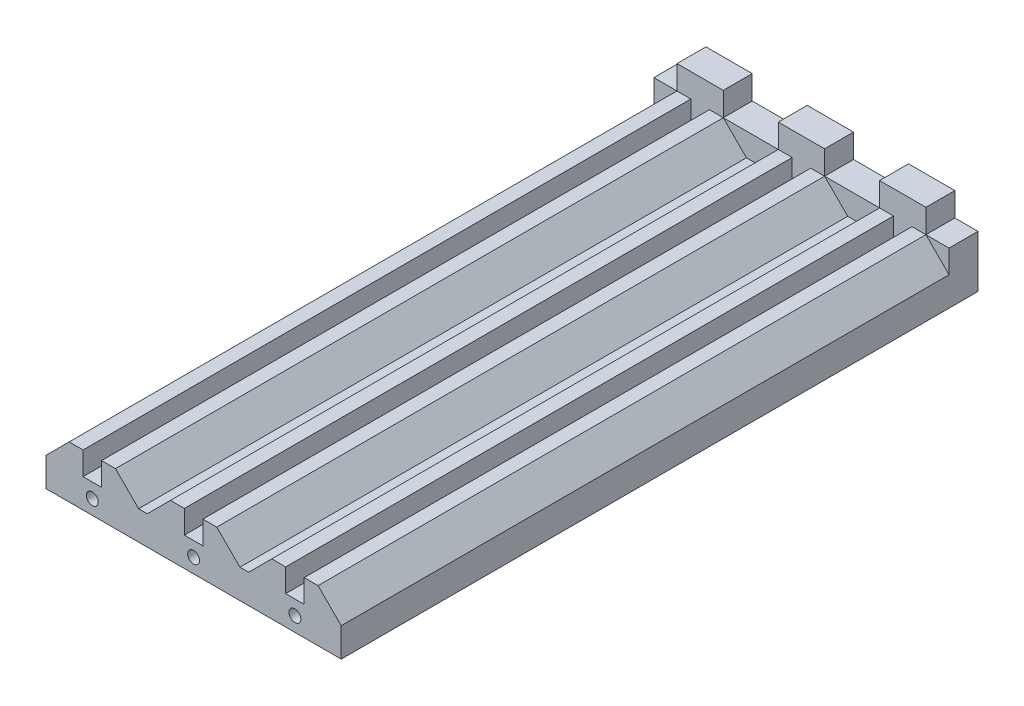
from build123d import *
from build123d.topology import SkipClean

# Parameters (mm, degrees)
EXTRUDE_1_DEPTH     = 170
CHAMFER_1_SIZE      = 8
SKETCH_2_W          = 170
SKETCH_2_H          = 10
CUT_EXTRUDE_1_DEPTH = 0.84
EXTRUDE_2_DEPTH     = 80
SKETCH_4_W          = 250
SKETCH_4_H          = 10
CUT_EXTRUDE_2_DEPTH = 12
SKETCH_5_W          = 101.997424074
SKETCH_5_H          = 18
EXTRUDE_3_DEPTH     = 10
SKETCH_6_R          = 2.05
CUT_EXTRUDE_3_DEPTH = 5
SKETCH_7_W          = 16
SKETCH_7_H          = 10
EXTRUDE_4_DEPTH     = 8.2
CUT_EXTRUDE_5_DEPTH = 40
SKETCH_11_R         = 2.05
CUT_EXTRUDE_6_DEPTH = 5


with BuildPart() as part:
    # 草图1 → 凸台-拉伸1 (new body)
    with BuildSketch(Plane.XY):
        Polygon((28.8, -113.2), (35.2, -113.2), (35.2, -105.2), (40, -105.2), (40, -113.2), (59, -113.2), (59, -105.2), (63.8, -105.2), (63.8, -113.2), (70.2, -113.2), (70.2, -105.2), (75, -105.2), (75, -113.2), (94, -113.2), (94, -105.2), (98.8, -105.2), (98.8, -113.2), (105.2, -113.2), (105.2, -105.2), (110, -105.2), (110, -113.2), (130, -113.2), (130, -123.2), (15.162575926, -123.2), (15.162575926, -113.2), (24, -113.2), (24, -105.2), (28.8, -105.2), align=None)
    extrude(amount=-EXTRUDE_1_DEPTH)

    # 倒角1
    chamfer_1_edges = [part.edges().sort_by_distance(p)[0] for p in [
        (24, -113.2, -85),
        (110, -113.2, -85),
        (94, -113.2, -85),
        (75, -113.2, -85),
        (59, -113.2, -85),
        (40, -113.2, -85),
    ]]
    chamfer(chamfer_1_edges, length=CHAMFER_1_SIZE - 0.0001)  # a hair under: the kernel refuses the full size

    # 草图2 → 切除-拉伸1 (cut)
    with BuildSketch(Plane.ZY.offset(-15.162575926)):
        with Locations((-85, -118.2)):
            Rectangle(SKETCH_2_W, SKETCH_2_H)
    extrude(amount=-CUT_EXTRUDE_1_DEPTH, mode=Mode.SUBTRACT)

    # 草图3 → 凸台-拉伸2 (add)
    with SkipClean():  # the faces are left unmerged after this step: merging them gives an invalid solid
        with BuildSketch(Plane.XY):
            Polygon((24, -105.2), (16, -113.2), (16.002575926, -113.2), (16.002575926, -123.2), (130, -123.2), (130, -113.2), (118, -113.2), (110, -105.2), (105.2, -105.2), (105.2, -113.2), (98.8, -113.2), (98.8, -105.2), (94, -105.2), (86, -113.2), (83, -113.2), (75, -105.2), (70.2, -105.2), (70.2, -113.2), (63.8, -113.2), (63.8, -105.2), (59, -105.2), (51, -113.2), (48, -113.2), (40, -105.2), (35.2, -105.2), (35.2, -113.2), (28.8, -113.2), (28.8, -105.2), align=None)
        extrude(amount=EXTRUDE_2_DEPTH)

    # 草图4 → 切除-拉伸2 (cut)
    with SkipClean():  # the faces are left unmerged after this step: merging them gives an invalid solid
        with BuildSketch(Plane(origin=(130, 0, 0), x_dir=(0, 0, -1), z_dir=(1, 0, 0))):
            with Locations((45, -118.2)):
                Rectangle(SKETCH_4_W, SKETCH_4_H)
        extrude(amount=-CUT_EXTRUDE_2_DEPTH, mode=Mode.SUBTRACT)

    # 草图5 → 凸台-拉伸3 (add)
    with SkipClean():  # the faces are left unmerged after this step: merging them gives an invalid solid
        with BuildSketch(Plane(origin=(0, 0, -170), x_dir=(-1, 0, 0), z_dir=(0, 0, -1))):
            with Locations((-67.001287963, -114.2)):
                Rectangle(SKETCH_5_W, SKETCH_5_H)
        extrude(amount=EXTRUDE_3_DEPTH)

    # 草图6 → 切除-拉伸3 (cut)
    with SkipClean():  # the faces are left unmerged after this step: merging them gives an invalid solid
        with BuildSketch(Plane.XZ.offset(123.2)):
            with Locations(Location((21.002575926, 25, 0), (0, 0, 270))):
                Circle(SKETCH_6_R)
            with Locations(Location((21.002575926, 0, 0), (0, 0, 270))):
                Circle(SKETCH_6_R)
            with Locations(Location((21.002575926, -57.5, 0), (0, 0, 270))):
                Circle(SKETCH_6_R)
            with Locations(Location((21.002575926, -82.5, 0), (0, 0, 270))):
                Circle(SKETCH_6_R)
            with Locations(Location((21.002575926, -140, 0), (0, 0, 270))):
                Circle(SKETCH_6_R)
            with Locations(Location((21.002575926, -165, 0), (0, 0, 270))):
                Circle(SKETCH_6_R)
            with Locations(Location((113, -140, 0), (0, 0, 270))):
                Circle(SKETCH_6_R)
            with Locations(Location((113, -82.5, 0), (0, 0, 270))):
                Circle(SKETCH_6_R)
            with Locations(Location((113, -57.5, 0), (0, 0, 270))):
                Circle(SKETCH_6_R)
            with Locations(Location((113, 0, 0), (0, 0, 270))):
                Circle(SKETCH_6_R)
            with Locations(Location((113, 25, 0), (0, 0, 270))):
                Circle(SKETCH_6_R)
            with Locations(Location((113, -165, 0), (0, 0, 270))):
                Circle(SKETCH_6_R)
        extrude(amount=-CUT_EXTRUDE_3_DEPTH, mode=Mode.SUBTRACT)

    # 草图7 → 凸台-拉伸4 (add)
    with SkipClean():  # the faces are left unmerged after this step: merging them gives an invalid solid
        with BuildSketch(Plane(origin=(0, -105.2, 0), x_dir=(1, 0, 0), z_dir=(0, 1, 0))):
            with Locations((102, 175)):
                Rectangle(SKETCH_7_W, SKETCH_7_H)
            with Locations((67, 175)):
                Rectangle(SKETCH_7_W, SKETCH_7_H)
            with Locations((32, 175)):
                Rectangle(SKETCH_7_W, SKETCH_7_H)
        extrude(amount=EXTRUDE_4_DEPTH)

    # 草图10 → 切除-拉伸5 (cut)
    with SkipClean():  # the faces are left unmerged after this step: merging them gives an invalid solid
        with BuildSketch(Plane.XY.offset(80)):
            Polygon((16.002575926, -123.2), (118, -123.2), (118, -113.2), (110, -105.2), (105.2, -105.2), (105.2, -113.2), (98.8, -113.2), (98.8, -105.2), (94, -105.2), (86, -113.2), (83, -113.2), (75, -105.2), (70.2, -105.2), (70.2, -113.2), (63.8, -113.2), (63.8, -105.2), (59, -105.2), (51, -113.2), (48, -113.2), (40, -105.2), (35.2, -105.2), (35.2, -113.2), (28.8, -113.2), (28.8, -105.2), (24, -105.2), (16, -113.2), (16.002575926, -113.2), align=None)
        extrude(amount=-CUT_EXTRUDE_5_DEPTH, mode=Mode.SUBTRACT)

    # 草图11 → 切除-拉伸6 (cut)
    with SkipClean():  # the faces are left unmerged after this step: merging them gives an invalid solid
        with BuildSketch(Plane.XY.offset(40)):
            with Locations((32, -118.2)):
                Circle(SKETCH_11_R)
            with Locations((67, -118.2)):
                Circle(SKETCH_11_R)
            with Locations((102, -118.2)):
                Circle(SKETCH_11_R)
        extrude(amount=-CUT_EXTRUDE_6_DEPTH, mode=Mode.SUBTRACT)


solid = part.part
